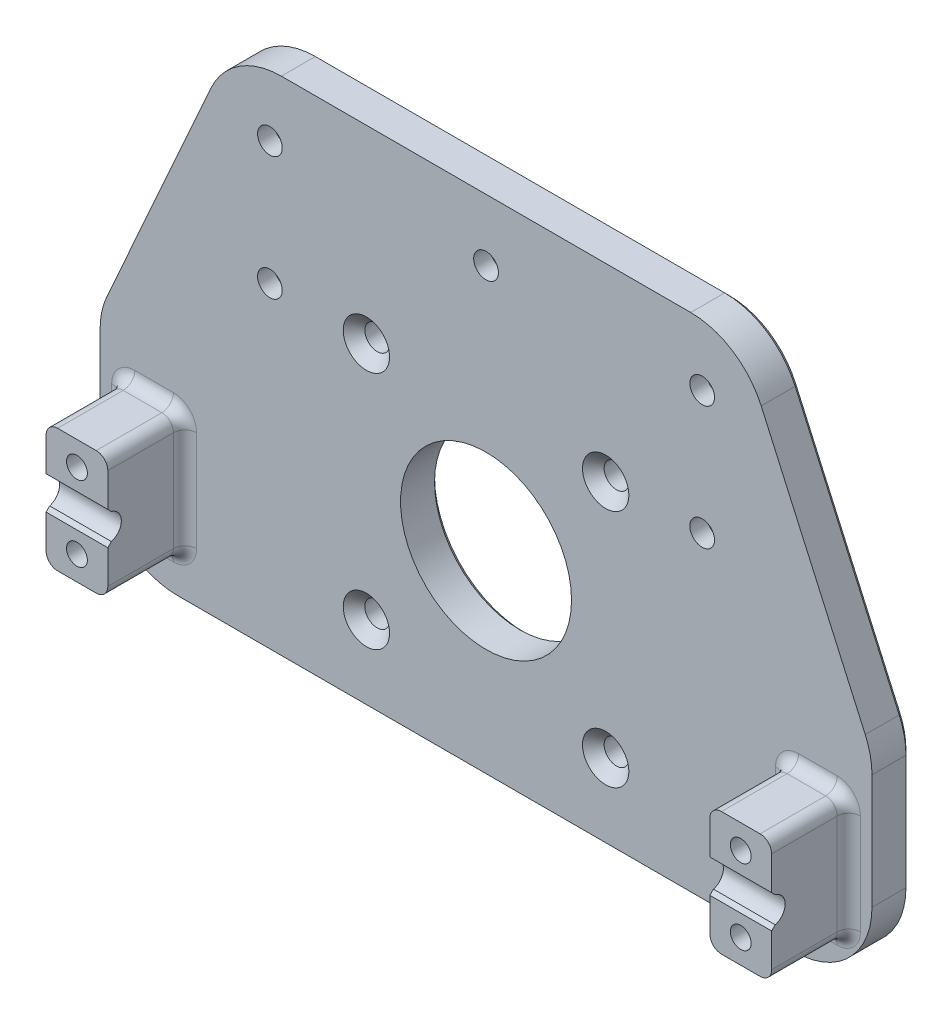
from build123d import *

# Parameters (mm, degrees)
SKETCH1_W               = 100
SKETCH1_H               = 80
BOSS_EXTRUDE1_DEPTH     = 5
SKETCH2_R               = 1.6
SKETCH2_R_2             = 11.075
CUT_EXTRUDE1_DEPTH      = 5
SKETCH4_R               = 1.6
CUT_EXTRUDE2_DEPTH      = 18
SKETCH5_W               = 8
SKETCH5_H               = 16
BOSS_EXTRUDE2_DEPTH     = 10
SKETCH6_R               = 1.75
CUT_EXTRUDE3_DEPTH      = 10
SKETCH7_R               = 1.35
CUT_EXTRUDE4_DEPTH      = 25
CUT_EXTRUDE5_DEPTH      = 65.807406984
CUT_EXTRUDE5_DEPTH_BACK = 65.807406984
SKETCH8_W               = 100
SKETCH8_H               = 15
FILLET1_R               = 10
FILLET2_R               = 1.5
CHAMFER1_SIZE           = 0.6
CHAMFER2_SIZE           = 0.4
CHAMFER3_SIZE           = 1.4
CHAMFER4_SIZE           = 0.6
CORTAR_EXTRUIR1_DEPTH   = 2.6
CHAFL_N1_SIZE           = 0.4
CROQUIS2_W              = 5.6
CROQUIS2_H              = 3.233161508
CORTAR_EXTRUIR2_DEPTH   = 0.2


with BuildPart() as part:
    # Sketch1 → Boss-Extrude1 (new body)
    with BuildSketch(Plane.XY):
        Rectangle(SKETCH1_W, SKETCH1_H)
    extrude(amount=BOSS_EXTRUDE1_DEPTH)

    # Sketch2 → Cut-Extrude1 (cut)
    with BuildSketch(Plane.XY.offset(5)):
        with Locations((-15.5, 15.5)):
            Circle(SKETCH2_R)
        with Locations((-15.5, -15.5)):
            Circle(SKETCH2_R)
        with Locations((15.5, -15.5)):
            Circle(SKETCH2_R)
        with Locations((15.5, 15.5)):
            Circle(SKETCH2_R)
        Circle(SKETCH2_R_2)
    extrude(amount=-CUT_EXTRUDE1_DEPTH, mode=Mode.SUBTRACT)

    # Sketch4 → Cut-Extrude2 (cut)
    with BuildSketch(Plane.XY.offset(5)):
        with Locations((28, 32)):
            Circle(SKETCH4_R)
        with Locations((0, 32)):
            Circle(SKETCH4_R)
        with Locations(Location((-28, 32, 0), (0, 0, 180))):
            Circle(SKETCH4_R)
        with Locations((28, 16)):
            Circle(SKETCH4_R)
        with Locations(Location((-28, 16, 0), (0, 0, 180))):
            Circle(SKETCH4_R)
    extrude(amount=-CUT_EXTRUDE2_DEPTH, mode=Mode.SUBTRACT)

    # Sketch5 → Boss-Extrude2 (add)
    with BuildSketch(Plane.XY.offset(5)):
        with Locations((-43, -12)):
            Rectangle(SKETCH5_W, SKETCH5_H)
    boss_extrude2 = extrude(amount=BOSS_EXTRUDE2_DEPTH)

    # Sketch6 → Cut-Extrude3 (cut)
    with BuildSketch(Plane.ZY.offset(47)):
        with Locations((15, -12)):
            Circle(SKETCH6_R)
    cut_extrude3 = extrude(amount=-CUT_EXTRUDE3_DEPTH, mode=Mode.SUBTRACT)

    # Sketch7 → Cut-Extrude4 (cut)
    with BuildSketch(Plane.XY.offset(15)):
        with Locations((-43, -16.875)):
            Circle(SKETCH7_R)
        with Locations((-43, -7.125)):
            Circle(SKETCH7_R)
    cut_extrude4 = extrude(amount=-CUT_EXTRUDE4_DEPTH, mode=Mode.SUBTRACT)

    # Mirror1: Boss-Extrude2, Cut-Extrude3, Cut-Extrude4 across plane
    add(boss_extrude2.mirror(Plane(origin=(0, 0, 0), x_dir=(0, 0, 1), z_dir=(1, 0, 0))))
    add(cut_extrude3.mirror(Plane(origin=(0, 0, 0), x_dir=(0, 0, 1), z_dir=(1, 0, 0))), mode=Mode.SUBTRACT)
    add(cut_extrude4.mirror(Plane(origin=(0, 0, 0), x_dir=(0, 0, 1), z_dir=(1, 0, 0))), mode=Mode.SUBTRACT)

    # Sketch8 → Cut-Extrude5 (cut, two sides: drawn at the far end of the back side and taken through both)
    with BuildSketch(Plane.XY.offset(5).offset(-CUT_EXTRUDE5_DEPTH_BACK)):
        with Locations((0, -32.5)):
            Rectangle(SKETCH8_W, SKETCH8_H)
        Polygon((-50, 2), (-33, 40), (-50, 40), align=None)
        Polygon((50, 2), (33, 40), (50, 40), align=None)
    extrude(amount=CUT_EXTRUDE5_DEPTH + CUT_EXTRUDE5_DEPTH_BACK, mode=Mode.SUBTRACT)

    # Fillet1
    fillet1_edges = [part.edges().sort_by_distance(p)[0] for p in [
        (50, -25, 2.5),
        (-50, -25, 2.5),
        (-50, 2, 2.5),
        (-33, 40, 2.5),
        (50, 2, 2.5),
        (33, 40, 2.5),
    ]]
    fillet(fillet1_edges, radius=FILLET1_R)

    # Fillet2
    fillet2_edges = [part.edges().sort_by_distance(p)[0] for p in [
        (-39, -12, 5),
        (-39, -20, 10),
        (-43, -4, 5),
        (-39, -4, 10),
        (-47, -12, 5),
        (-47, -4, 10),
        (-43, -20, 5),
        (-47, -20, 10),
        (39, -4, 10),
        (39, -20, 10),
        (47, -20, 10),
        (47, -4, 10),
        (39, -12, 5),
        (43, -4, 5),
        (47, -12, 5),
        (43, -20, 5),
    ]]
    fillet(fillet2_edges, radius=FILLET2_R)

    # Chamfer1
    chamfer1_edges = [part.edges().sort_by_distance(p)[0] for p in [
        (44.35, -16.875, 0),
        (44.35, -7.125, 0),
        (42.387482967, 19.016214544, 0),
        (0, 40, 0),
        (0, -25, 0),
        (-50, -7.567446057, 0),
        (-42.387482967, 19.016214544, 0),
        (50, -7.567446057, 0),
        (-31.957506761, 38.391561416, 0),
        (-49.779617201, 1.95295065, 0),
        (-47.071067812, -22.071067812, 0),
        (47.071067812, -22.071067812, 0),
        (49.779617201, 1.95295065, 0),
        (31.957506761, 38.391561416, 0),
        (13.9, 15.5, 0),
        (13.9, -15.5, 0),
        (-17.1, -15.5, 0),
        (-17.1, 15.5, 0),
        (-44.35, -16.875, 0),
        (-44.35, -7.125, 0),
    ]]
    chamfer(chamfer1_edges, length=CHAMFER1_SIZE)

    # Chamfer2
    # the kernel refuses this chamfer: 0.4 mm, written as the material it takes off along each edge
    with BuildSketch(Plane(origin=(37.802269816, -13.75, 15), x_dir=(0, 0.13322104766360263, -0.9910863496484109), z_dir=(1, 0, 0))) as chamfer2_piece_1:
        with BuildLine():
            Line((0.466273667, 0), (-CHAMFER2_SIZE * 0.133221047664, -CHAMFER2_SIZE * 0.991086349648))
            Line((-CHAMFER2_SIZE * 0.133221047664, -CHAMFER2_SIZE * 0.991086349648), (0, 0))
            ThreePointArc((0, 0), (0.23957204, -0.015587056), (0.466273667, 0))
        make_face()
    extrude(amount=10.395460367, mode=Mode.SUBTRACT)
    with BuildSketch(Plane(origin=(37.802269816, -10.25, 15), x_dir=(0, 1, 0), z_dir=(1, 0, 0))) as chamfer2_piece_2:
        with BuildLine():
            Line((CHAMFER2_SIZE, 0), (-0.062117466, -0.462117466))
            ThreePointArc((-0.062117466, -0.462117466), (-0.01646792, -0.239513102), (0, 0))
            Line((0, 0), (CHAMFER2_SIZE, 0))
        make_face()
    extrude(amount=10.395460367, mode=Mode.SUBTRACT)
    with BuildSketch(Plane(origin=(-37.802269816, -10.25, 15), x_dir=(0, 1, 0), z_dir=(-1, 0, 0))) as chamfer2_piece_3:
        with BuildLine():
            Line((CHAMFER2_SIZE, 0), (-0.062117466, 0.462117466))
            ThreePointArc((-0.062117466, 0.462117466), (-0.01646792, 0.239513102), (0, 0))
            Line((0, 0), (CHAMFER2_SIZE, 0))
        make_face()
    extrude(amount=10.395460367, mode=Mode.SUBTRACT)
    with BuildSketch(Plane(origin=(-37.802269816, -13.75, 15), x_dir=(0, 0.13322104766360263, -0.9910863496484109), z_dir=(-1, 0, 0))) as chamfer2_piece_4:
        with BuildLine():
            Line((0.466273667, 0), (-CHAMFER2_SIZE * 0.133221047664, CHAMFER2_SIZE * 0.991086349648))
            Line((-CHAMFER2_SIZE * 0.133221047664, CHAMFER2_SIZE * 0.991086349648), (0, 0))
            ThreePointArc((0, 0), (0.23957204, 0.015587056), (0.466273667, 0))
        make_face()
    extrude(amount=10.395460367, mode=Mode.SUBTRACT)

    # Chamfer3
    chamfer3_edges = [part.edges().sort_by_distance(p)[0] for p in [
        (13.9, 15.5, 5),
        (13.9, -15.5, 5),
        (-17.1, -15.5, 5),
        (-17.1, 15.5, 5),
    ]]
    chamfer(chamfer3_edges, length=CHAMFER3_SIZE)

    # Chamfer4
    chamfer4_edges = [part.edges().sort_by_distance(p)[0] for p in [
        (-11.075, 0, 0),
    ]]
    chamfer(chamfer4_edges, length=CHAMFER4_SIZE)

    # Croquis1 → Cortar-Extruir1 (cut)
    with BuildSketch(Plane(origin=(0, 0, 0), x_dir=(-1, 0, 0), z_dir=(0, 0, -1))):
        Polygon((-28, 28.766838493), (-25.2, 30.383419246), (-25.2, 33.616580754), (-28, 35.233161507), (-30.8, 33.616580754), (-30.8, 30.383419246), align=None)
        Polygon((-28, 12.766838493), (-25.2, 14.383419246), (-25.2, 17.616580754), (-28, 19.233161507), (-30.8, 17.616580754), (-30.8, 14.383419246), align=None)
        Polygon((0, 28.766838493), (2.8, 30.383419246), (2.8, 33.616580754), (0, 35.233161507), (-2.8, 33.616580754), (-2.8, 30.383419246), align=None)
        Polygon((30.8, 14.383419246), (28, 12.766838493), (25.2, 14.383419246), (25.2, 17.616580754), (28, 19.233161507), (30.8, 17.616580754), align=None)
        Polygon((30.8, 30.383419246), (28, 28.766838493), (25.2, 30.383419246), (25.2, 33.616580754), (28, 35.233161507), (30.8, 33.616580754), align=None)
    extrude(amount=-CORTAR_EXTRUIR1_DEPTH, mode=Mode.SUBTRACT)

    # Chaflán1
    chafl_n1_edges = [part.edges().sort_by_distance(p)[0] for p in [
        (-30.8, 32, 0),
        (-29.4, 34.424871131, 0),
        (-26.6, 34.424871131, 0),
        (-25.2, 32, 0),
        (-26.6, 29.575128869, 0),
        (-29.4, 29.575128869, 0),
        (-30.8, 16, 0),
        (-29.4, 18.424871131, 0),
        (-26.6, 18.424871131, 0),
        (-25.2, 16, 0),
        (-26.6, 13.575128869, 0),
        (-29.4, 13.575128869, 0),
        (1.4, 29.575128869, 0),
        (-1.4, 29.575128869, 0),
        (-2.8, 32, 0),
        (-1.4, 34.424871131, 0),
        (1.4, 34.424871131, 0),
        (2.8, 32, 0),
        (29.4, 13.575128869, 0),
        (26.6, 13.575128869, 0),
        (25.2, 16, 0),
        (26.6, 18.424871131, 0),
        (29.4, 18.424871131, 0),
        (30.8, 16, 0),
        (29.4, 29.575128869, 0),
        (26.6, 29.575128869, 0),
        (25.2, 32, 0),
        (26.6, 34.424871131, 0),
        (29.4, 34.424871131, 0),
        (30.8, 32, 0),
    ]]
    chamfer(chafl_n1_edges, length=CHAFL_N1_SIZE)

    # Croquis2 → Cortar-Extruir2 (cut)
    with BuildSketch(Plane(origin=(0, 0, 2.6), x_dir=(-1, 0, 0), z_dir=(0, 0, -1))):
        with Locations((-28, 32)):
            Rectangle(CROQUIS2_W, CROQUIS2_H)
        with Locations((-28, 16)):
            Rectangle(CROQUIS2_W, CROQUIS2_H)
        with Locations((0, 32)):
            Rectangle(CROQUIS2_W, CROQUIS2_H)
        with Locations((28, 16)):
            Rectangle(CROQUIS2_W, CROQUIS2_H)
        with Locations((28, 32)):
            Rectangle(CROQUIS2_W, CROQUIS2_H)
    extrude(amount=-CORTAR_EXTRUIR2_DEPTH, mode=Mode.SUBTRACT)


solid = part.part
